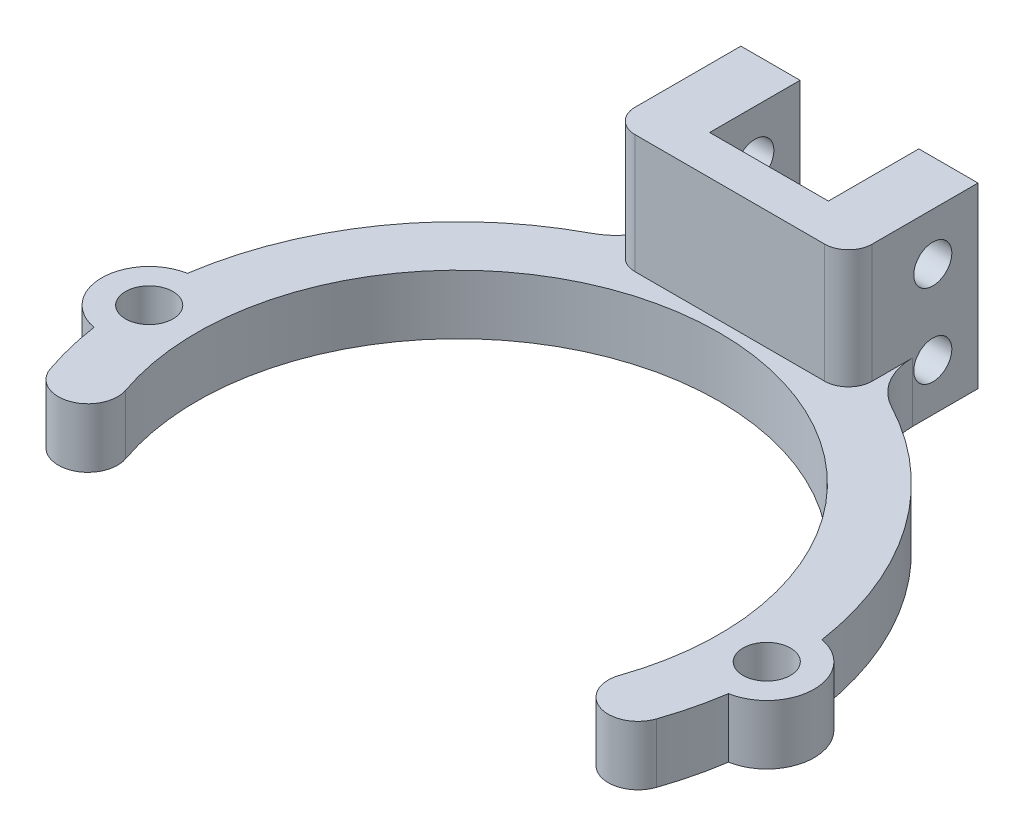
from build123d import *

# Parameters (mm, degrees)
SKETCH_1_R          = 2
EXTRUDE_1_DEPTH     = 5
EXTRUDE_2_DEPTH     = 15
SKETCH_5_W          = 10
SKETCH_5_H          = 7.614001554
CUT_EXTRUDE_2_DEPTH = 47.291611568
SKETCH_4_R          = 1.6
CUT_EXTRUDE_1_DEPTH = 55.466038362
FILLET_2_R          = 5
FILLET_3_R          = 2


with BuildPart() as part:
    # 草图1 → 凸台-拉伸1 (new body)
    with BuildSketch(Plane(origin=(0, 0, 0), x_dir=(1, 0, 0), z_dir=(0, 1, 0))):
        with BuildLine():
            ThreePointArc((20.794105787, -7.183673469), (0, 22), (-20.794105787, -7.183673469))
            ThreePointArc((-20.794105787, -7.183673469), (-22.340745823, -10.362966567), (-25.520038921, -8.816326531))
            ThreePointArc((-25.520038921, -8.816326531), (-26.229531343, -6.404036657), (-26.711538462, -3.936205408))
            ThreePointArc((-26.711538462, -3.936205408), (-30, 0), (-26.711538462, 3.936205408))
            ThreePointArc((-26.711538462, 3.936205408), (0, 27), (26.711538462, 3.936205408))
            ThreePointArc((26.711538462, 3.936205408), (30, 0), (26.711538462, -3.936205408))
            ThreePointArc((26.711538462, -3.936205408), (26.229531343, -6.404036657), (25.520038921, -8.816326531))
            ThreePointArc((25.520038921, -8.816326531), (22.340745823, -10.362966567), (20.794105787, -7.183673469))
        make_face()
        with Locations((-26, 0)):
            Circle(SKETCH_1_R, mode=Mode.SUBTRACT)
        with Locations((26, 0)):
            Circle(SKETCH_1_R, mode=Mode.SUBTRACT)
    extrude(amount=EXTRUDE_1_DEPTH)

    # 草图3 → 凸台-拉伸2 (add)
    with BuildSketch(Plane(origin=(0, 0, 0), x_dir=(1, 0, 0), z_dir=(0, 1, 0))):
        Polygon((-5, 33.807000777), (-9.982946782, 33.807000777), (-9.982946782, 22.896387671), (9.982946782, 22.896387671), (9.982946782, 33.807000777), (5, 33.807000777), (5, 26.192999223), (-5, 26.192999223), align=None)
    extrude(amount=EXTRUDE_2_DEPTH)

    # 草图5 → 切除-拉伸2 (cut, through all)
    with BuildSketch(Plane(origin=(0, 5, 0), x_dir=(1, 0, 0), z_dir=(0, 1, 0))):
        with Locations((0, 30)):
            Rectangle(SKETCH_5_W, SKETCH_5_H)
    extrude(amount=-CUT_EXTRUDE_2_DEPTH, mode=Mode.SUBTRACT)

    # 草图4 → 切除-拉伸1 (cut, through all)
    with BuildSketch(Plane.ZY.offset(9.982946782)):
        with Locations((-30, 4)):
            Circle(SKETCH_4_R)
        with Locations((-30, 11)):
            Circle(SKETCH_4_R)
    extrude(amount=-CUT_EXTRUDE_1_DEPTH, mode=Mode.SUBTRACT)

    # 圆角2
    fillet_2_edges = [part.edges().sort_by_distance(p)[0] for p in [
        (9.982946782, 2.5, -25.086665254),
        (-9.982946782, 2.5, -25.086665254),
    ]]
    fillet(fillet_2_edges, radius=FILLET_2_R)

    # 圆角3
    fillet_3_edges = [part.edges().sort_by_distance(p)[0] for p in [
        (9.982946782, 10, -22.896387671),
        (-9.982946782, 10, -22.896387671),
    ]]
    fillet(fillet_3_edges, radius=FILLET_3_R)


solid = part.part
